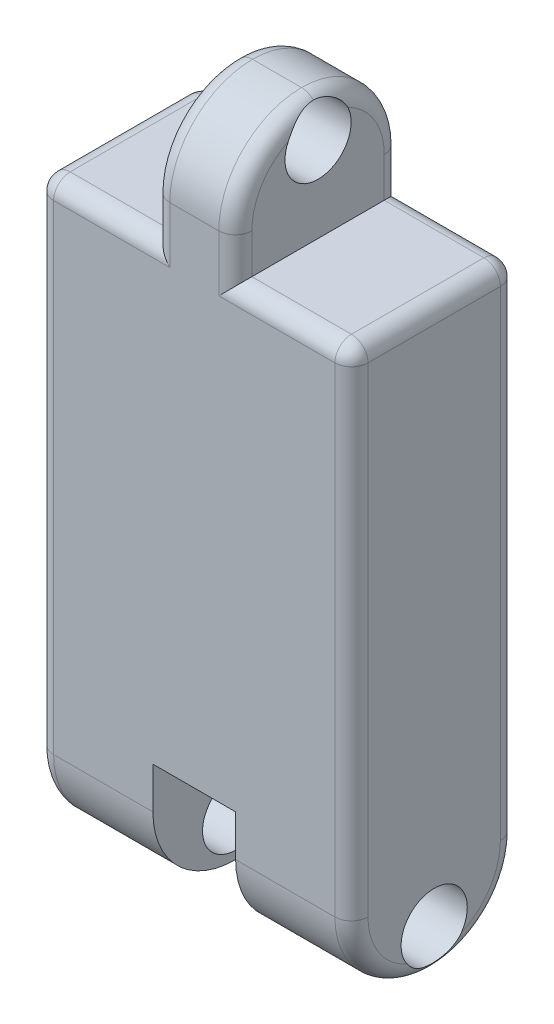
from build123d import *

# Parameters (mm, degrees)
BOSS_EXTRUDE1_DEPTH = 100
SKETCH2_W           = 50
SKETCH2_H           = 50
CUT_EXTRUDE1_DEPTH  = 285.650663094
FILLET1_R           = 50
CUT_EXTRUDE2_DEPTH  = 25
SKETCH7_R           = 20
CUT_EXTRUDE3_DEPTH  = 329.7871652
FILLET2_R           = 50
SKETCH9_W           = 50
SKETCH9_H           = 12.5
CUT_EXTRUDE6_DEPTH  = 285.650663094
CUT_EXTRUDE7_DEPTH  = 25
FILLET3_R           = 10
SKETCH11_W          = 50
SKETCH11_H          = 25
CUT_EXTRUDE8_DEPTH  = 99
BOSS_EXTRUDE7_DEPTH = 0.1
FILLET4_R           = 10
FILLET5_R           = 10
SKETCH14_R          = 20
CUT_EXTRUDE9_DEPTH  = 294.892922803


# Some blends are built 0.0001 mm under size
with BuildPart() as part:
    # Sketch1 → Boss-Extrude1 (new body)
    with BuildSketch(Plane.XY):
        Polygon((-24.8, 175), (-24.8, 249), (24.8, 249), (24.8, 175), (95, 175), (95, -175), (-95, -175), (-95, 175), align=None)
    extrude(amount=-BOSS_EXTRUDE1_DEPTH)

    # Sketch2 → Cut-Extrude1 (cut, through all)
    with BuildSketch(Plane.XY):
        with Locations((0, -175)):
            Rectangle(SKETCH2_W, SKETCH2_H)
    extrude(amount=-CUT_EXTRUDE1_DEPTH, mode=Mode.SUBTRACT)

    # Fillet1
    fillet1_edges = [part.edges().sort_by_distance(p)[0] for p in [
        (0, 249, -100),
        (0, 249, 0),
    ]]
    fillet(fillet1_edges, radius=FILLET1_R - 0.0001)  # a hair under: the kernel refuses the full size

    # Sketch6 → Cut-Extrude2 (cut, symmetric)
    with BuildSketch(Plane(origin=(0, 0, 0), x_dir=(0, 0, -1), z_dir=(1, 0, 0))):
        with BuildLine():
            Line((100, -150), (0, -150))
            ThreePointArc((0, -150), (50, -100), (100, -150))
        make_face()
    extrude(amount=CUT_EXTRUDE2_DEPTH, both=True, mode=Mode.SUBTRACT)

    # Sketch7 → Cut-Extrude3 (cut, through all)
    with BuildSketch(Plane.ZY.offset(95)):
        with Locations(Location((-50, -150, 0), (0, 0, 270))):
            Circle(SKETCH7_R)
    extrude(amount=-CUT_EXTRUDE3_DEPTH, mode=Mode.SUBTRACT)

    # Fillet2
    # the kernel refuses this fillet: 50 mm, written as the material it takes off along each edge
    with BuildSketch(Plane(origin=(100, -175, -100), x_dir=(0, 1, 0), z_dir=(-1, 0, 0))) as fillet2_piece_1:
        with BuildLine():
            CenterArc((FILLET2_R, -FILLET2_R), FILLET2_R, 90, 90)
            Line((0, -FILLET2_R), (0, 0))
            Line((0, 0), (FILLET2_R, 0))
        make_face()
    extrude(amount=320, mode=Mode.SUBTRACT)
    with BuildSketch(Plane(origin=(100, -175, 0), x_dir=(0, 1, 0), z_dir=(-1, 0, 0))) as fillet2_piece_2:
        with BuildLine():
            CenterArc((FILLET2_R, FILLET2_R), FILLET2_R, 180, 90)
            Line((0, FILLET2_R), (0, 0))
            Line((0, 0), (FILLET2_R, 0))
        make_face()
    extrude(amount=320, mode=Mode.SUBTRACT)

    # Sketch9 → Cut-Extrude6 (cut, through all)
    with BuildSketch(Plane.XY):
        with Locations((0, -131.25)):
            Rectangle(SKETCH9_W, SKETCH9_H)
    extrude(amount=-CUT_EXTRUDE6_DEPTH, mode=Mode.SUBTRACT)

    # Sketch10 → Cut-Extrude7 (cut, symmetric)
    with BuildSketch(Plane(origin=(0, 0, 0), x_dir=(0, 0, -1), z_dir=(1, 0, 0))):
        with BuildLine():
            Line((0, -125), (100, -125))
            ThreePointArc((100, -125), (50, -111.611517322), (0, -125))
        make_face()
    extrude(amount=CUT_EXTRUDE7_DEPTH, both=True, mode=Mode.SUBTRACT)

    # Fillet3
    # the kernel refuses this fillet: 10 mm, written as the material it takes off along each edge
    with BuildSketch(Plane(origin=(24.8, 199.0001, -100), x_dir=(-1, 0, 0), z_dir=(0, -1, 0)), Plane(origin=(-24.8, 175, 0), x_dir=(0, 0, -1), z_dir=(0, 1, 0))) as fillet3_piece_1:
        with BuildLine():
            CenterArc((FILLET3_R, -FILLET3_R), FILLET3_R, 90, 90)
            Line((0, -FILLET3_R), (0, 0))
            Line((0, 0), (FILLET3_R, 0))
        make_face()
    extrude(amount=24.0001, mode=Mode.SUBTRACT)
    with BuildSketch(Plane(origin=(24.8, 175, 0), x_dir=(0, -1, 0), z_dir=(1, 0, 0)), Plane(origin=(-120, 175, 0), x_dir=(0, -1, 0), z_dir=(1, 0, 0))) as fillet3_piece_2:
        with BuildLine():
            CenterArc((FILLET3_R, FILLET3_R), FILLET3_R, 180, 90)
            Line((0, FILLET3_R), (0, 0))
            Line((0, 0), (FILLET3_R, 0))
        make_face()
    extrude(amount=95.2, mode=Mode.SUBTRACT)
    with BuildSketch(Plane(origin=(-120, 175, -100), x_dir=(0, -1, 0), z_dir=(1, 0, 0)), Plane(origin=(24.8, 175, -100), x_dir=(0, -1, 0), z_dir=(1, 0, 0))) as fillet3_piece_3:
        with BuildLine():
            CenterArc((FILLET3_R, -FILLET3_R), FILLET3_R, 90, 90)
            Line((0, -FILLET3_R), (0, 0))
            Line((0, 0), (FILLET3_R, 0))
        make_face()
    extrude(amount=95.2, mode=Mode.SUBTRACT)
    with BuildSketch(Plane(origin=(-95, -125, -100), x_dir=(1, 0, 0), z_dir=(0, 1, 0)), Plane(origin=(95, 200, -100), x_dir=(-1, 0, 0), z_dir=(0, -1, 0))) as fillet3_piece_4:
        with BuildLine():
            CenterArc((FILLET3_R, -FILLET3_R), FILLET3_R, 90, 90)
            Line((0, -FILLET3_R), (0, 0))
            Line((0, 0), (FILLET3_R, 0))
        make_face()
    extrude(amount=325, mode=Mode.SUBTRACT)
    with BuildSketch(Plane(origin=(-24.8, 175, -100), x_dir=(0, 0, 1), z_dir=(0, 1, 0)), Plane(origin=(24.8, 199.0001, 0), x_dir=(-1, 0, 0), z_dir=(0, -1, 0))) as fillet3_piece_5:
        with BuildLine():
            CenterArc((FILLET3_R, FILLET3_R), FILLET3_R, 180, 90)
            Line((0, FILLET3_R), (0, 0))
            Line((0, 0), (FILLET3_R, 0))
        make_face()
    extrude(amount=24.0001, mode=Mode.SUBTRACT)
    with BuildSketch(Plane(origin=(-24.8, 199.0001, -49.9999), x_dir=(0, 1, 0), z_dir=(0, 0, -1))) as fillet3_piece_6:
        with BuildLine():
            CenterArc((49.9999 - FILLET3_R, FILLET3_R), FILLET3_R, 270, 90)
            Line((49.9999, FILLET3_R), (49.9999, 0))
            Line((49.9999, 0), (49.9999 - FILLET3_R, 0))
        make_face()
    revolve(axis=Axis((-24.8, 199.0001, -49.9999), (1, 0, 0)), revolution_arc=90, mode=Mode.SUBTRACT)
    with BuildSketch(Plane(origin=(-24.8, 199.0001, -50.0001), x_dir=(0, 1, 0), z_dir=(0, 0, 1))) as fillet3_piece_7:
        with BuildLine():
            CenterArc((49.9999 - FILLET3_R, -FILLET3_R), FILLET3_R, 0, 90)
            Line((49.9999, -FILLET3_R), (49.9999, 0))
            Line((49.9999, 0), (49.9999 - FILLET3_R, 0))
        make_face()
    revolve(axis=Axis((-24.8, 199.0001, -50.0001), (-1, 0, 0)), revolution_arc=90, mode=Mode.SUBTRACT)
    with BuildSketch(Plane(origin=(24.8, 199.0001, -49.9999), x_dir=(0, 1, 0), z_dir=(0, 0, -1))) as fillet3_piece_8:
        with BuildLine():
            CenterArc((49.9999 - FILLET3_R, -FILLET3_R), FILLET3_R, 0, 90)
            Line((49.9999 - FILLET3_R, 0), (49.9999, 0))
            Line((49.9999, 0), (49.9999, -FILLET3_R))
        make_face()
    revolve(axis=Axis((24.8, 199.0001, -49.9999), (1, 0, 0)), revolution_arc=90, mode=Mode.SUBTRACT)
    with BuildSketch(Plane(origin=(24.8, 199.0001, -50.0001), x_dir=(0, 1, 0), z_dir=(0, 0, 1))) as fillet3_piece_9:
        with BuildLine():
            CenterArc((49.9999 - FILLET3_R, FILLET3_R), FILLET3_R, 270, 90)
            Line((49.9999 - FILLET3_R, 0), (49.9999, 0))
            Line((49.9999, 0), (49.9999, FILLET3_R))
        make_face()
    revolve(axis=Axis((24.8, 199.0001, -50.0001), (-1, 0, 0)), revolution_arc=90, mode=Mode.SUBTRACT)
    with BuildSketch(Plane(origin=(95, 200, 0), x_dir=(-1, 0, 0), z_dir=(0, -1, 0)), Plane(origin=(-95, -125, 0), x_dir=(1, 0, 0), z_dir=(0, 1, 0))) as fillet3_piece_10:
        with BuildLine():
            CenterArc((FILLET3_R, FILLET3_R), FILLET3_R, 180, 90)
            Line((0, FILLET3_R), (0, 0))
            Line((0, 0), (FILLET3_R, 0))
        make_face()
    extrude(amount=325, mode=Mode.SUBTRACT)
    with BuildSketch(Plane(origin=(95, -125, -50), x_dir=(0, 0, -1), z_dir=(0, 1, 0))) as fillet3_piece_11:
        with BuildLine():
            CenterArc((50 - FILLET3_R, FILLET3_R), FILLET3_R, 270, 90)
            Line((50 - FILLET3_R, 0), (50, 0))
            Line((50, 0), (50, FILLET3_R))
        make_face()
    revolve(axis=Axis((95, -125, -50), (-1, 0, 0)), revolution_arc=180, mode=Mode.SUBTRACT)
    with BuildSketch(Plane(origin=(-95, -125, -50), x_dir=(0, 0, -1), z_dir=(0, 1, 0))) as fillet3_piece_12:
        with BuildLine():
            CenterArc((50 - FILLET3_R, -FILLET3_R), FILLET3_R, 0, 90)
            Line((50, -FILLET3_R), (50, 0))
            Line((50, 0), (50 - FILLET3_R, 0))
        make_face()
    revolve(axis=Axis((-95, -125, -50), (-1, 0, 0)), revolution_arc=180, mode=Mode.SUBTRACT)
    with BuildSketch(Plane(origin=(24.8, 249, -49.9999), x_dir=(-1, 0, 0), z_dir=(0, 0, -1)), Plane(origin=(-24.8, 249, -49.9999), x_dir=(0, -1, 0), z_dir=(0, 0, -1))) as fillet3_piece_13:
        with BuildLine():
            CenterArc((FILLET3_R, -FILLET3_R), FILLET3_R, 90, 90)
            Line((0, -FILLET3_R), (0, 0))
            Line((0, 0), (FILLET3_R, 0))
        make_face()
    extrude(amount=0.0002, mode=Mode.SUBTRACT)
    with BuildSketch(Plane(origin=(-0.2, 175, -100), x_dir=(0, -1, 0), z_dir=(1, 0, 0))) as fillet3_piece_14a_section:
        with BuildLine():
            CenterArc((FILLET3_R, -FILLET3_R), FILLET3_R, 90, 90)
            Line((0, -FILLET3_R), (0, 0))
            Line((0, 0), (FILLET3_R, 0))
        make_face()
    fillet3_piece_14a = extrude(amount=120.2, mode=Mode.PRIVATE)
    fillet3_piece_14a = split(fillet3_piece_14a, bisect_by=Plane(origin=(24.8, 172.736048857, -97.736048857), z_dir=(-1, 0, 0)), keep=Keep.TOP, mode=Mode.PRIVATE)
    with BuildSketch(Plane(origin=(24.8, 199.0001, -100), x_dir=(-1, 0, 0), z_dir=(0, -1, 0))) as fillet3_piece_14b_section:
        with BuildLine():
            CenterArc((FILLET3_R, -FILLET3_R), FILLET3_R, 90, 90)
            Line((0, -FILLET3_R), (0, 0))
            Line((0, 0), (FILLET3_R, 0))
        make_face()
    fillet3_piece_14b = extrude(amount=49.0001, mode=Mode.PRIVATE)
    fillet3_piece_14b = split(fillet3_piece_14b, bisect_by=Plane(origin=(22.536048857, 175, -97.736048857), z_dir=(0, -1, 0)), keep=Keep.TOP, mode=Mode.PRIVATE)
    fillet3_piece_14 = fillet3_piece_14a & fillet3_piece_14b
    add(fillet3_piece_14, mode=Mode.SUBTRACT)
    with BuildSketch(Plane(origin=(-0.2, 175, 0), x_dir=(0, -1, 0), z_dir=(1, 0, 0))) as fillet3_piece_15a_section:
        with BuildLine():
            CenterArc((FILLET3_R, FILLET3_R), FILLET3_R, 180, 90)
            Line((0, FILLET3_R), (0, 0))
            Line((0, 0), (FILLET3_R, 0))
        make_face()
    fillet3_piece_15a = extrude(amount=120.2, mode=Mode.PRIVATE)
    fillet3_piece_15a = split(fillet3_piece_15a, bisect_by=Plane(origin=(24.8, 172.736048857, -2.263951143), z_dir=(-1, 0, 0)), keep=Keep.TOP, mode=Mode.PRIVATE)
    with BuildSketch(Plane(origin=(24.8, 199.0001, 0), x_dir=(-1, 0, 0), z_dir=(0, -1, 0))) as fillet3_piece_15b_section:
        with BuildLine():
            CenterArc((FILLET3_R, FILLET3_R), FILLET3_R, 180, 90)
            Line((0, FILLET3_R), (0, 0))
            Line((0, 0), (FILLET3_R, 0))
        make_face()
    fillet3_piece_15b = extrude(amount=49.0001, mode=Mode.PRIVATE)
    fillet3_piece_15b = split(fillet3_piece_15b, bisect_by=Plane(origin=(22.536048857, 175, -2.263951143), z_dir=(0, -1, 0)), keep=Keep.TOP, mode=Mode.PRIVATE)
    fillet3_piece_15 = fillet3_piece_15a & fillet3_piece_15b
    add(fillet3_piece_15, mode=Mode.SUBTRACT)
    with BuildSketch(Plane(origin=(-24.8, 150, -100), x_dir=(0, 0, 1), z_dir=(0, 1, 0))) as fillet3_piece_16a_section:
        with BuildLine():
            CenterArc((FILLET3_R, FILLET3_R), FILLET3_R, 180, 90)
            Line((0, FILLET3_R), (0, 0))
            Line((0, 0), (FILLET3_R, 0))
        make_face()
    fillet3_piece_16a = extrude(amount=49.0001, mode=Mode.PRIVATE)
    fillet3_piece_16a = split(fillet3_piece_16a, bisect_by=Plane(origin=(-22.536048857, 175, -97.736048857), z_dir=(0, -1, 0)), keep=Keep.TOP, mode=Mode.PRIVATE)
    with BuildSketch(Plane(origin=(-120, 175, -100), x_dir=(0, -1, 0), z_dir=(1, 0, 0))) as fillet3_piece_16b_section:
        with BuildLine():
            CenterArc((FILLET3_R, -FILLET3_R), FILLET3_R, 90, 90)
            Line((0, -FILLET3_R), (0, 0))
            Line((0, 0), (FILLET3_R, 0))
        make_face()
    fillet3_piece_16b = extrude(amount=120.2, mode=Mode.PRIVATE)
    fillet3_piece_16b = split(fillet3_piece_16b, bisect_by=Plane(origin=(-24.8, 172.736048857, -97.736048857), z_dir=(1, 0, 0)), keep=Keep.TOP, mode=Mode.PRIVATE)
    fillet3_piece_16 = fillet3_piece_16a & fillet3_piece_16b
    add(fillet3_piece_16, mode=Mode.SUBTRACT)
    with BuildSketch(Plane(origin=(-24.8, 150, 0), x_dir=(0, 0, -1), z_dir=(0, 1, 0))) as fillet3_piece_17a_section:
        with BuildLine():
            CenterArc((FILLET3_R, -FILLET3_R), FILLET3_R, 90, 90)
            Line((0, -FILLET3_R), (0, 0))
            Line((0, 0), (FILLET3_R, 0))
        make_face()
    fillet3_piece_17a = extrude(amount=49.0001, mode=Mode.PRIVATE)
    fillet3_piece_17a = split(fillet3_piece_17a, bisect_by=Plane(origin=(-22.536048857, 175, -2.263951143), z_dir=(0, -1, 0)), keep=Keep.TOP, mode=Mode.PRIVATE)
    with BuildSketch(Plane(origin=(-120, 175, 0), x_dir=(0, -1, 0), z_dir=(1, 0, 0))) as fillet3_piece_17b_section:
        with BuildLine():
            CenterArc((FILLET3_R, FILLET3_R), FILLET3_R, 180, 90)
            Line((0, FILLET3_R), (0, 0))
            Line((0, 0), (FILLET3_R, 0))
        make_face()
    fillet3_piece_17b = extrude(amount=120.2, mode=Mode.PRIVATE)
    fillet3_piece_17b = split(fillet3_piece_17b, bisect_by=Plane(origin=(-24.8, 172.736048857, -2.263951143), z_dir=(1, 0, 0)), keep=Keep.TOP, mode=Mode.PRIVATE)
    fillet3_piece_17 = fillet3_piece_17a & fillet3_piece_17b
    add(fillet3_piece_17, mode=Mode.SUBTRACT)

    # Sketch11 → Cut-Extrude8 (cut)
    with BuildSketch(Plane.XY):
        with Locations((0, -112.5)):
            Rectangle(SKETCH11_W, SKETCH11_H)
    extrude(amount=-CUT_EXTRUDE8_DEPTH, mode=Mode.SUBTRACT)

    # Fillet5
    # the kernel refuses this fillet: 10 mm, written as the material it takes off along each edge
    with BuildSketch(Plane(origin=(85, 165, -10), x_dir=(0, 1, 0), z_dir=(1, 0, 0))) as fillet5_piece_1_section:
        Polygon((0, 0), (FILLET5_R, 0), (FILLET5_R, FILLET5_R), (0, FILLET5_R), align=None)
    fillet5_piece_1 = extrude(amount=FILLET5_R, mode=Mode.PRIVATE)
    fillet5_piece_1 = fillet5_piece_1 - Plane(origin=(85, 165, -10), x_dir=(0, -0.7071067811865475, -0.7071067811865475), z_dir=(1, 0, 0)) * Sphere(FILLET5_R, mode=Mode.PRIVATE)
    add(fillet5_piece_1, mode=Mode.SUBTRACT)
    with BuildSketch(Plane(origin=(85, 165, -90), x_dir=(0, 1, 0), z_dir=(1, 0, 0))) as fillet5_piece_2_section:
        Polygon((0, 0), (FILLET5_R, 0), (FILLET5_R, -FILLET5_R), (0, -FILLET5_R), align=None)
    fillet5_piece_2 = extrude(amount=FILLET5_R, mode=Mode.PRIVATE)
    fillet5_piece_2 = fillet5_piece_2 - Plane(origin=(85, 165, -90), x_dir=(0, -0.7071067811865475, 0.7071067811865475), z_dir=(1, 0, 0)) * Sphere(FILLET5_R, mode=Mode.PRIVATE)
    add(fillet5_piece_2, mode=Mode.SUBTRACT)
    with BuildSketch(Plane(origin=(-85, 165, -90), x_dir=(0, 1, 0), z_dir=(-1, 0, 0))) as fillet5_piece_3_section:
        Polygon((0, 0), (FILLET5_R, 0), (FILLET5_R, FILLET5_R), (0, FILLET5_R), align=None)
    fillet5_piece_3 = extrude(amount=FILLET5_R, mode=Mode.PRIVATE)
    fillet5_piece_3 = fillet5_piece_3 - Plane(origin=(-85, 165, -90), x_dir=(0, -0.7071067811865475, 0.7071067811865475), z_dir=(-1, 0, 0)) * Sphere(FILLET5_R, mode=Mode.PRIVATE)
    add(fillet5_piece_3, mode=Mode.SUBTRACT)
    with BuildSketch(Plane(origin=(-85, 165, -10), x_dir=(0, 1, 0), z_dir=(-1, 0, 0))) as fillet5_piece_4_section:
        Polygon((0, 0), (FILLET5_R, 0), (FILLET5_R, -FILLET5_R), (0, -FILLET5_R), align=None)
    fillet5_piece_4 = extrude(amount=FILLET5_R, mode=Mode.PRIVATE)
    fillet5_piece_4 = fillet5_piece_4 - Plane(origin=(-85, 165, -10), x_dir=(0, -0.7071067811865475, -0.7071067811865475), z_dir=(-1, 0, 0)) * Sphere(FILLET5_R, mode=Mode.PRIVATE)
    add(fillet5_piece_4, mode=Mode.SUBTRACT)
    with BuildSketch(Plane(origin=(95, 175, -10), x_dir=(0, -1, 0), z_dir=(0, 0, -1))) as fillet5_piece_5:
        with BuildLine():
            CenterArc((FILLET5_R, FILLET5_R), FILLET5_R, 180, 90)
            Line((0, FILLET5_R), (0, 0))
            Line((0, 0), (FILLET5_R, 0))
        make_face()
    extrude(amount=80, mode=Mode.SUBTRACT)
    with BuildSketch(Plane(origin=(-95, 175, -10), x_dir=(0, -1, 0), z_dir=(0, 0, -1))) as fillet5_piece_6:
        with BuildLine():
            CenterArc((FILLET5_R, -FILLET5_R), FILLET5_R, 90, 90)
            Line((0, -FILLET5_R), (0, 0))
            Line((0, 0), (FILLET5_R, 0))
        make_face()
    extrude(amount=80, mode=Mode.SUBTRACT)

    # Sketch14 → Cut-Extrude9 (cut, through all)
    with BuildSketch(Plane(origin=(24.8, 0, 0), x_dir=(0, 0, -1), z_dir=(1, 0, 0))):
        with Locations(Location((50, 226, 0), (0, 0, 25.856016698))):
            Circle(SKETCH14_R)
    extrude(amount=-CUT_EXTRUDE9_DEPTH, mode=Mode.SUBTRACT)


with BuildPart() as body_2:
    # Sketch13 → Boss-Extrude7 (new body)
    with BuildSketch(Plane(origin=(0, 0, -100), x_dir=(-1, 0, 0), z_dir=(0, 0, -1))):
        Polygon((-25, -125), (-25, -155), (25.018802851, -155), (25, -125), align=None)
    extrude(amount=BOSS_EXTRUDE7_DEPTH)

    # Fillet4
    # the kernel refuses this fillet: 10 mm, written as the material it takes off along each edge
    with BuildSketch(Plane(origin=(-25.021013242, -158.526683302, -100.1), x_dir=(0, 0, 1), z_dir=(0.000626761593063201, 0.9999998035849335, 0))) as fillet4_piece_1:
        with BuildLine():
            CenterArc((10, 1.410673598), FILLET4_R, 180, 8.109614456)
            Line((0, 1.410673598), (0, 0))
            Line((0, 0), (0.1, 0))
        make_face()
    extrude(amount=37.053373882, mode=Mode.SUBTRACT)
    with BuildSketch(Plane(origin=(25, -121.473316005, -100.1), x_dir=(0, 0, 1), z_dir=(0, -1, 0))) as fillet4_piece_2:
        with BuildLine():
            CenterArc((10, 1.410673598), FILLET4_R, 180, 8.109614456)
            Line((0, 1.410673598), (0, 0))
            Line((0, 0), (0.1, 0))
        make_face()
    extrude(amount=37.05336799, mode=Mode.SUBTRACT)
    with BuildSketch(Plane(origin=(28.526683995, -155, -100.1), x_dir=(0, 0, 1), z_dir=(-1, 0, 0))) as fillet4_piece_3:
        with BuildLine():
            CenterArc((10, 1.410673598), FILLET4_R, 180, 8.109614456)
            Line((0, 1.410673598), (0, 0))
            Line((0, 0), (0.1, 0))
        make_face()
    extrude(amount=57.072170841, mode=Mode.SUBTRACT)


solid = Compound([part.part, body_2.part])
